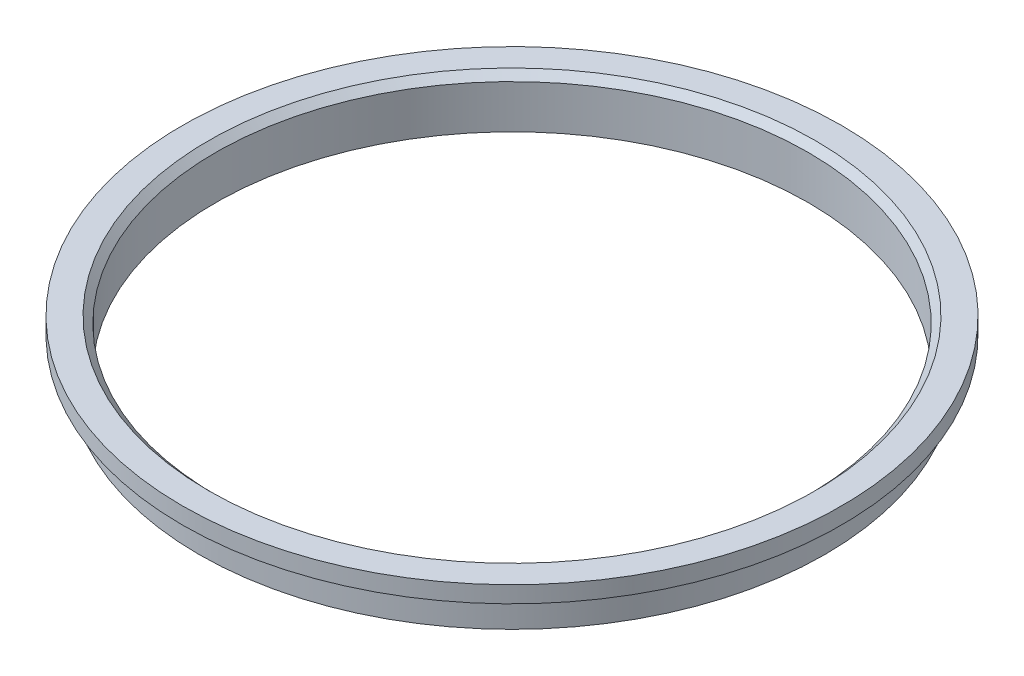
from build123d import *

# Parameters (mm, degrees)
CHAMFER1_SIZE = 1.27
FILLET1_R     = 1.5875


with BuildPart() as part:
    # Sketch1 → Revolve1 (revolve)
    with BuildSketch(Plane.XY):
        Polygon((-54.5465, 0), (-54.5465, -9.271), (-57.5945, -9.271), (-57.5945, -3.048), (-60.6425, -3.048), (-60.6425, 0), align=None)
    revolve(axis=Axis((0, 0, 0), (0, 1, 0)))

    # Chamfer1
    chamfer1_edges = [part.edges().sort_by_distance(p)[0] for p in [
        (54.5465, 0, 0),
    ]]
    chamfer(chamfer1_edges, length=CHAMFER1_SIZE)

    # Fillet1
    fillet1_edges = [part.edges().sort_by_distance(p)[0] for p in [
        (57.5945, -3.048, 0),
    ]]
    fillet(fillet1_edges, radius=FILLET1_R)


solid = part.part
